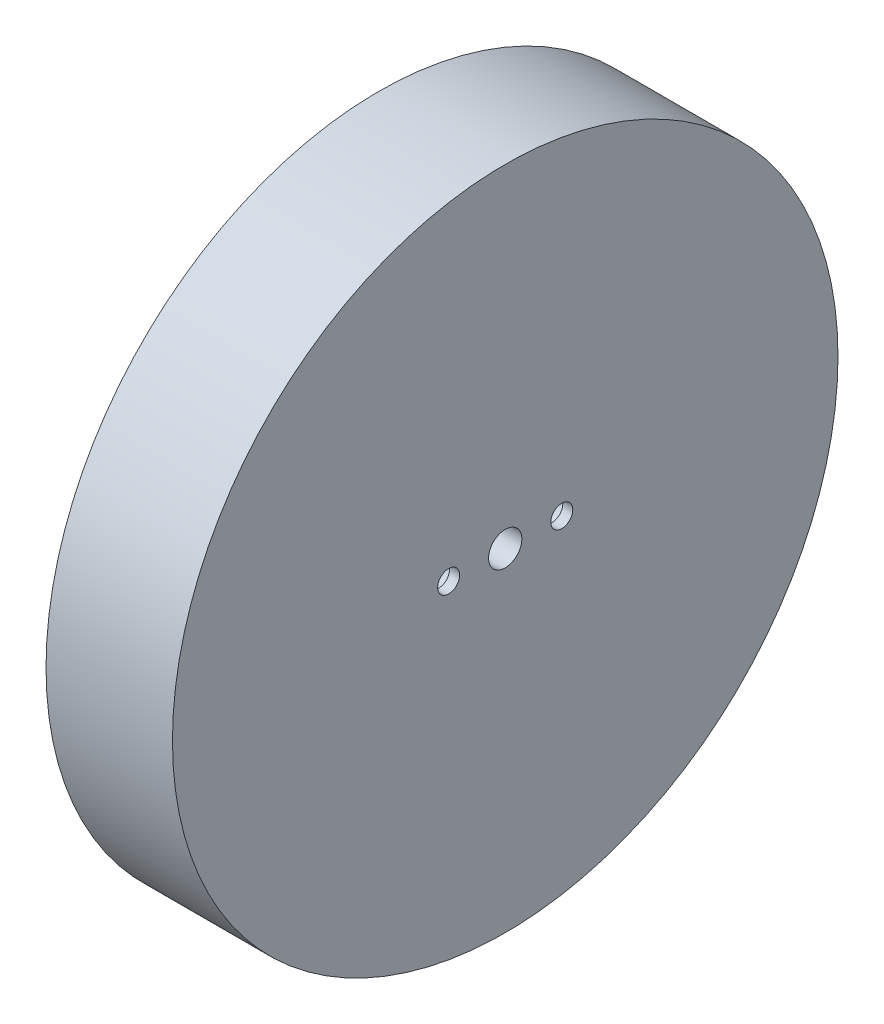
from build123d import *

# Parameters (mm, degrees)
BASPROSKE_W         = 15
BASPROSKE_H         = 8.5
TOOTHCUT_DEPTH      = 73.284161474
TEETHCUTS_COUNT     = 85
TEETHCUTS_ANGLE     = 355.764705882
BOSS_EXTRUDE1_START = 4
SKETCH1_R           = 50
BOSS_EXTRUDE1_DEPTH = 4
SKETCH2_R           = 2.5
CUT_EXTRUDE1_DEPTH  = 4
SKETCH3_R           = 1.65
CUT_EXTRUDE2_DEPTH  = 4
SKETCH4_R           = 2.75
CUT_EXTRUDE3_DEPTH  = 2.5


with BuildPart() as part:
    # BasProSke → Base-Revolve (revolve)
    with BuildSketch(Plane(origin=(0, 0, 0), x_dir=(1, 0, 0), z_dir=(0, 1, 0))):
        with Locations((7.5, 45.75)):
            Rectangle(BASPROSKE_W, BASPROSKE_H)
    revolve(axis=Axis((-10, 0, 0), (1, 0, 0)))

    # TooCutSke → ToothCut (cut, through all)
    with BuildSketch(Plane(origin=(0, 0, 0), x_dir=(0, 0, -1), z_dir=(1, 0, 0))):
        with BuildLine():
            ThreePointArc((1.224835545, 41.45651002), (0.83497456, 42.615101041), (0.379137207, 43.749357206))
            ThreePointArc((0.379137207, 43.749357206), (0, 43.751), (-0.379137207, 43.749357206))
            ThreePointArc((-0.379137207, 43.749357206), (-0.83497456, 42.615101041), (-1.224835545, 41.45651002))
            ThreePointArc((-1.224835545, 41.45651002), (0, 41.4746), (1.224835545, 41.45651002))
        make_face()
    toothcut = extrude(amount=TOOTHCUT_DEPTH, mode=Mode.SUBTRACT)

    # TeethCuts: ToothCut ×85 about axis
    teethcuts_axis = Axis((-10, 0, 0), (1, 0, 0))
    for i in range(1, TEETHCUTS_COUNT):
        add(toothcut.rotate(teethcuts_axis, i * TEETHCUTS_ANGLE / (TEETHCUTS_COUNT - 1)), mode=Mode.SUBTRACT)

    # Sketch1 → Boss-Extrude1 (add)
    with BuildSketch(Plane(origin=(15, 0, 0), x_dir=(0, 0, -1), z_dir=(1, 0, 0)).offset(BOSS_EXTRUDE1_START)):
        Circle(SKETCH1_R)
    extrude(amount=-BOSS_EXTRUDE1_DEPTH)

    # Sketch2 → Cut-Extrude1 (cut)
    with BuildSketch(Plane(origin=(19, 0, 0), x_dir=(0, 0, -1), z_dir=(1, 0, 0))):
        Circle(SKETCH2_R)
    extrude(amount=-CUT_EXTRUDE1_DEPTH, mode=Mode.SUBTRACT)

    # Sketch3 → Cut-Extrude2 (cut)
    with BuildSketch(Plane(origin=(19, 0, 0), x_dir=(0, 0, -1), z_dir=(1, 0, 0))):
        with Locations((-8.5, 0)):
            Circle(SKETCH3_R)
        with Locations((8.5, 0)):
            Circle(SKETCH3_R)
    extrude(amount=-CUT_EXTRUDE2_DEPTH, mode=Mode.SUBTRACT)

    # Sketch4 → Cut-Extrude3 (cut)
    with BuildSketch(Plane.ZY.offset(-15)):
        with Locations((-8.5, 0)):
            Circle(SKETCH4_R)
        with Locations((8.5, 0)):
            Circle(SKETCH4_R)
    extrude(amount=-CUT_EXTRUDE3_DEPTH, mode=Mode.SUBTRACT)


solid = part.part
